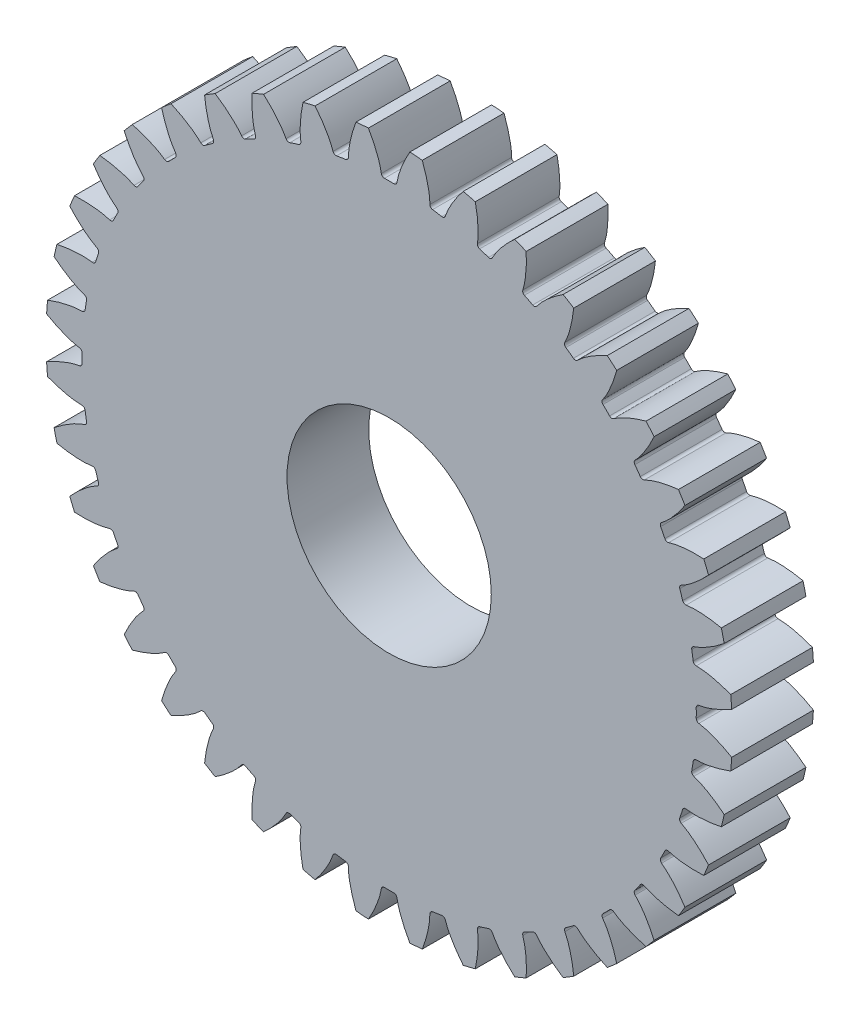
from build123d import *

# Parameters (mm, degrees)
CIRCLES_R                       = 42
GEAR_EXTRUDE_DEPTH              = 10
EXTRUDED_CUT1_DEPTH             = 61.232881386
FILLET1_R                       = 0.38
CIRCULAR_PARTTERN1_COUNT        = 40
FILLET1_OF_CIRCULAR_PARTTERN1_R = 0.38
SKETCH1_R                       = 12.5
CUT_EXTRUDE1_DEPTH              = 10


with BuildPart() as part:
    # circles → Gear_extrude (new body)
    with BuildSketch(Plane.XY):
        Circle(CIRCLES_R)
    extrude(amount=GEAR_EXTRUDE_DEPTH)

    # Db_Df → extruded-cut1 (cut, through all)
    with BuildSketch(Plane.XY.offset(10)):
        with BuildLine():
            Line((58.109349853, 39.015010136), (80.295990011, -3.154770064))
            Line((80.295990011, -3.154770064), (58.109349853, -39.015010136))
            add(Edge.make_bspline(
                [(37.576547872, -0.915753519), (37.645037779, -0.919703821), (37.836537268, -0.937817672), (38.195616211, -0.999757342), (38.773632235, -1.139697382), (39.49584808, -1.374253403), (40.407874353, -1.740734772), (41.45025177, -2.251717816), (42.55649088, -2.894158891), (44.001325746, -3.8722672), (45.363194123, -4.966829494), (46.643006799, -6.155338659), (48.047439903, -7.639858021), (49.362784238, -9.2047226), (50.774234564, -11.138662412), (52.218854325, -13.470837975), (53.515179506, -15.945994935), (54.641303957, -18.502900002), (55.482013472, -20.798111596), (56.102266952, -22.798931134), (56.553709624, -24.48441541), (56.876155023, -25.843262186), (57.231596266, -27.550850316), (57.524371056, -29.273306485), (57.756052869, -31.000378324), (57.927724076, -32.74111574), (58.02995547, -34.126163538), (58.088453555, -35.35962458), (58.11796854, -36.384422231), (58.127121064, -37.29270629), (58.128428781, -37.921056514), (58.11946838, -38.543367784), (58.113214534, -38.856428832), (58.109349853, -39.015010136)],
                knots=[0, 0, 0, 0, 0, 0.005376747, 0.015083687, 0.028531819, 0.046610138, 0.064854847, 0.092110523, 0.119476173, 0.146842493, 0.201574954, 0.228941012, 0.256307345, 0.307035031, 0.361767349, 0.416499658, 0.471231934, 0.525964279, 0.580696613, 0.608062797, 0.635428981, 0.662795184, 0.690161387, 0.744893689, 0.772259886, 0.799626084, 0.826992247, 0.854358411, 0.868041538, 0.881724665, 0.895407792, 0.909090919, 0.909090919, 0.909090919, 0.909090919, 0.909090919], degree=4))
            ThreePointArc((37.576547872, -0.915753519), (37.587704831, 0), (37.576547872, 0.915753519))
            add(Edge.make_bspline(
                [(37.576547872, 0.915753519), (37.645037779, 0.919703821), (37.836537268, 0.937817672), (38.195616211, 0.999757342), (38.773632235, 1.139697382), (39.49584808, 1.374253403), (40.407874353, 1.740734772), (41.45025177, 2.251717816), (42.55649088, 2.894158891), (44.001325746, 3.8722672), (45.363194123, 4.966829494), (46.643006799, 6.155338659), (48.047439903, 7.639858021), (49.362784238, 9.2047226), (50.774234564, 11.138662412), (52.218854325, 13.470837975), (53.515179506, 15.945994935), (54.641303957, 18.502900002), (55.482013472, 20.798111596), (56.102266952, 22.798931134), (56.553709624, 24.48441541), (56.876155023, 25.843262186), (57.231596266, 27.550850316), (57.524371056, 29.273306485), (57.756052869, 31.000378324), (57.927724076, 32.74111574), (58.02995547, 34.126163538), (58.088453555, 35.35962458), (58.11796854, 36.384422231), (58.127121064, 37.29270629), (58.128428781, 37.921056514), (58.11946838, 38.543367784), (58.113214534, 38.856428832), (58.109349853, 39.015010136)],
                knots=[0, 0, 0, 0, 0, 0.005376747, 0.015083687, 0.028531819, 0.046610138, 0.064854847, 0.092110523, 0.119476173, 0.146842493, 0.201574954, 0.228941012, 0.256307345, 0.307035031, 0.361767349, 0.416499658, 0.471231934, 0.525964279, 0.580696613, 0.608062797, 0.635428981, 0.662795184, 0.690161387, 0.744893689, 0.772259886, 0.799626084, 0.826992247, 0.854358411, 0.868041538, 0.881724665, 0.895407792, 0.909090919, 0.909090919, 0.909090919, 0.909090919, 0.909090919], degree=4))
        make_face()
    extruded_cut1 = extrude(amount=-EXTRUDED_CUT1_DEPTH, mode=Mode.SUBTRACT)

    # fillet1
    fillet1_edges = [part.edges().sort_by_distance(p)[0] for p in [
        (37.576547872, -0.915753519, 5),
        (37.576547872, 0.915753519, 5),
    ]]
    fillet(fillet1_edges, radius=FILLET1_R)

    # circular-parttern1: extruded-cut1 ×40 about axis
    circular_parttern1_axis = Axis((0, 0, 10), (0, 0, -1))
    for i in range(1, CIRCULAR_PARTTERN1_COUNT):
        add(extruded_cut1.rotate(circular_parttern1_axis, i * 360 / CIRCULAR_PARTTERN1_COUNT), mode=Mode.SUBTRACT)

    # fillet1 of circular-parttern1
    fillet1_of_circular_parttern1_edges = [part.edges().sort_by_distance(p)[0] for p in [
        (36.970662801, -6.782746238, 5),
        (37.257173625, -4.973788091, 5),
        (35.454437314, -12.482725234, 5),
        (36.020404114, -10.740858531, 5),
        (33.065205913, -17.875338107, 5),
        (33.896692708, -16.243453387, 5),
        (29.861799405, -22.827800831, 5),
        (30.938332232, -21.346080512, 5),
        (25.923096291, -27.218167337, 5),
        (27.218167337, -25.923096291, 5),
        (21.346080512, -30.938332232, 5),
        (22.827800831, -29.861799405, 5),
        (16.243453387, -33.896692708, 5),
        (17.875338107, -33.065205913, 5),
        (10.740858531, -36.020404114, 5),
        (12.482725234, -35.454437314, 5),
        (4.973788091, -37.257173625, 5),
        (6.782746238, -36.970662801, 5),
        (-0.915753519, -37.576547872, 5),
        (0.915753519, -37.576547872, 5),
        (-6.782746238, -36.970662801, 5),
        (-4.973788091, -37.257173625, 5),
        (-12.482725234, -35.454437314, 5),
        (-10.740858531, -36.020404114, 5),
        (-17.875338107, -33.065205913, 5),
        (-16.243453387, -33.896692708, 5),
        (-22.827800831, -29.861799405, 5),
        (-21.346080512, -30.938332232, 5),
        (-27.218167337, -25.923096291, 5),
        (-25.923096291, -27.218167337, 5),
        (-30.938332232, -21.346080512, 5),
        (-29.861799405, -22.827800831, 5),
        (-33.896692708, -16.243453387, 5),
        (-33.065205913, -17.875338107, 5),
        (-36.020404114, -10.740858531, 5),
        (-35.454437314, -12.482725234, 5),
        (-37.257173625, -4.973788091, 5),
        (-36.970662801, -6.782746238, 5),
        (-37.576547872, 0.915753519, 5),
        (-37.576547872, -0.915753519, 5),
        (-36.970662801, 6.782746238, 5),
        (-37.257173625, 4.973788091, 5),
        (-35.454437314, 12.482725234, 5),
        (-36.020404114, 10.740858531, 5),
        (-33.065205913, 17.875338107, 5),
        (-33.896692708, 16.243453387, 5),
        (-29.861799405, 22.827800831, 5),
        (-30.938332232, 21.346080512, 5),
        (-25.923096291, 27.218167337, 5),
        (-27.218167337, 25.923096291, 5),
        (-21.346080512, 30.938332232, 5),
        (-22.827800831, 29.861799405, 5),
        (-16.243453387, 33.896692708, 5),
        (-17.875338107, 33.065205913, 5),
        (-10.740858531, 36.020404114, 5),
        (-12.482725234, 35.454437314, 5),
        (-4.973788091, 37.257173625, 5),
        (-6.782746238, 36.970662801, 5),
        (0.915753519, 37.576547872, 5),
        (-0.915753519, 37.576547872, 5),
        (6.782746238, 36.970662801, 5),
        (4.973788091, 37.257173625, 5),
        (12.482725234, 35.454437314, 5),
        (10.740858531, 36.020404114, 5),
        (17.875338107, 33.065205913, 5),
        (16.243453387, 33.896692708, 5),
        (22.827800831, 29.861799405, 5),
        (21.346080512, 30.938332232, 5),
        (27.218167337, 25.923096291, 5),
        (25.923096291, 27.218167337, 5),
        (30.938332232, 21.346080512, 5),
        (29.861799405, 22.827800831, 5),
        (33.896692708, 16.243453387, 5),
        (33.065205913, 17.875338107, 5),
        (36.020404114, 10.740858531, 5),
        (35.454437314, 12.482725234, 5),
        (37.257173625, 4.973788091, 5),
        (36.970662801, 6.782746238, 5),
    ]]
    fillet(fillet1_of_circular_parttern1_edges, radius=FILLET1_OF_CIRCULAR_PARTTERN1_R)

    # Sketch1 → Cut-Extrude1 (cut)
    with BuildSketch(Plane.XY):
        Circle(SKETCH1_R)
    extrude(amount=CUT_EXTRUDE1_DEPTH, mode=Mode.SUBTRACT)


solid = part.part
